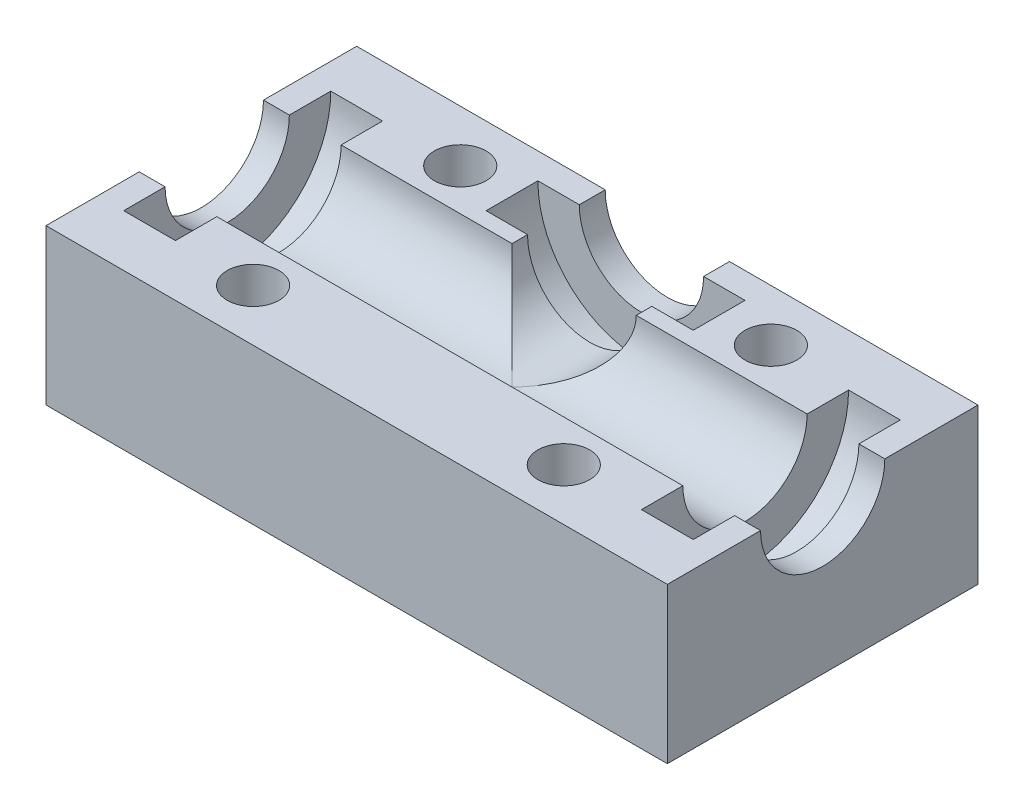
from build123d import *

# Parameters (mm, degrees)
SKETCH1_W           = 60
SKETCH1_H           = 30
SKETCH1_R           = 2.5
BOSS_EXTRUDE1_DEPTH = 30
SKETCH2_R           = 6
CUT_EXTRUDE1_DEPTH  = 74.484692283
CUT_EXTRUDE2_START  = -2.5
SKETCH2_4_R         = 10
SKETCH2_4_R_2       = 6
CUT_EXTRUDE2_DEPTH  = 5
SKETCH6_R           = 6
CUT_EXTRUDE5_DEPTH  = 15
CUT_EXTRUDE6_START  = -2.5
SKETCH6_3_R         = 10
CUT_EXTRUDE6_DEPTH  = 5


with BuildPart() as part:
    # Sketch1 → Boss-Extrude1 (new body)
    with BuildSketch(Plane(origin=(0, 0, 0), x_dir=(1, 0, 0), z_dir=(0, 1, 0))):
        with Locations((30, 15)):
            Rectangle(SKETCH1_W, SKETCH1_H)
        with Locations((45, 25)):
            Circle(SKETCH1_R, mode=Mode.SUBTRACT)
        with Locations((45, 5)):
            Circle(SKETCH1_R, mode=Mode.SUBTRACT)
        with Locations((15, 5)):
            Circle(SKETCH1_R, mode=Mode.SUBTRACT)
        with Locations((15, 25)):
            Circle(SKETCH1_R, mode=Mode.SUBTRACT)
    extrude(amount=BOSS_EXTRUDE1_DEPTH)

    # Sketch2 → Cut-Extrude1 (cut, through all)
    with BuildSketch(Plane.ZY):
        with Locations((-15, 15)):
            Circle(SKETCH2_R)
    extrude(amount=-CUT_EXTRUDE1_DEPTH, mode=Mode.SUBTRACT)

    # Sketch2<4> → Cut-Extrude2 (cut)
    with BuildSketch(Plane.ZY.offset(CUT_EXTRUDE2_START)):
        with Locations((-15, 15)):
            Circle(SKETCH2_4_R)
        with Locations((-15, 15)):
            Circle(SKETCH2_4_R_2, mode=Mode.SUBTRACT)
    cut_extrude2 = extrude(amount=-CUT_EXTRUDE2_DEPTH, mode=Mode.SUBTRACT)

    # Mirror1: Cut-Extrude2 across plane
    add(cut_extrude2.mirror(Plane.ZY.offset(-30)), mode=Mode.SUBTRACT)

    # Sketch6 → Cut-Extrude5 (cut)
    with BuildSketch(Plane(origin=(0, 0, -30), x_dir=(-1, 0, 0), z_dir=(0, 0, -1))):
        with Locations((-30, 15)):
            Circle(SKETCH6_R)
    extrude(amount=-CUT_EXTRUDE5_DEPTH, mode=Mode.SUBTRACT)

    # Sketch6<3> → Cut-Extrude6 (cut)
    with BuildSketch(Plane(origin=(0, 0, -30), x_dir=(-1, 0, 0), z_dir=(0, 0, -1)).offset(CUT_EXTRUDE6_START)):
        with Locations((-30, 15)):
            Circle(SKETCH6_3_R)
    extrude(amount=-CUT_EXTRUDE6_DEPTH, mode=Mode.SUBTRACT)


with BuildPart() as body_2:
    # Split2: the piece on the far side of the plane
    add(part.part)
    split(bisect_by=Plane(origin=(0, 15, 0), x_dir=(0, 0, -1), z_dir=(0, -1, 0)), keep=Keep.BOTTOM)


with BuildPart() as part_1:
    add(part.part)

    # Split2
    split(bisect_by=Plane(origin=(0, 15, 0), x_dir=(0, 0, -1), z_dir=(0, -1, 0)), keep=Keep.TOP)


solid = part_1.part
